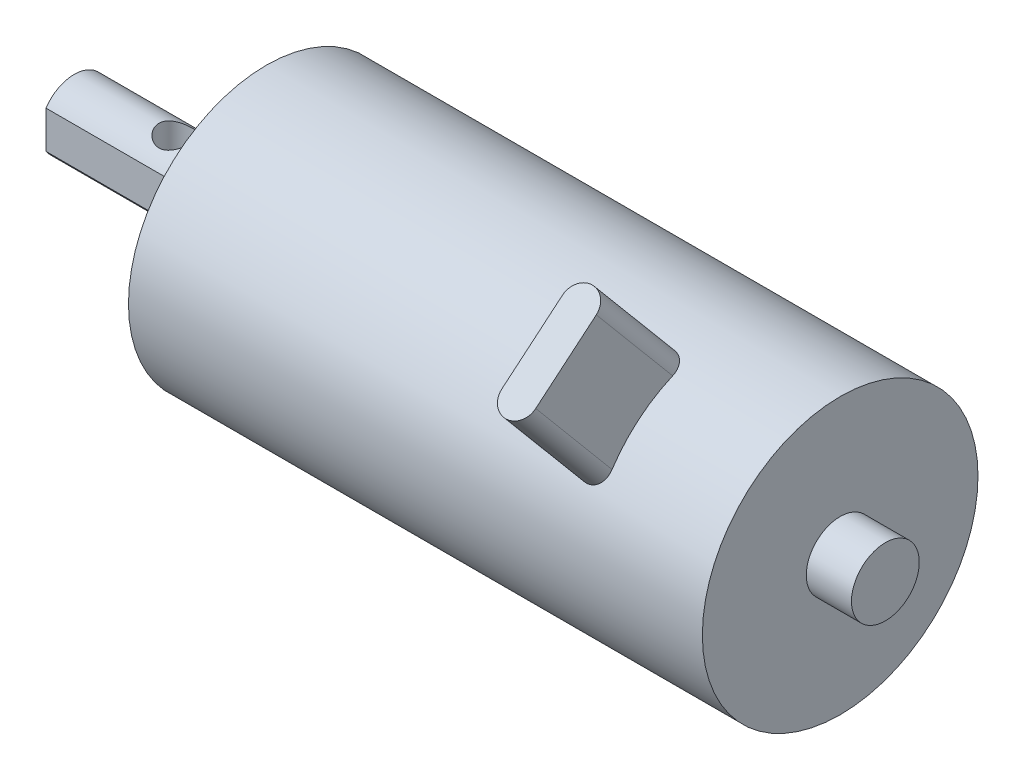
from build123d import *

# Parameters (mm, degrees)
HOLE_WIZARD_M3_1_D       = 2.5
HOLE_WIZARD_M3_1_DEPTH   = 4
HOLE_WIZARD_M3_1_TIP     = 0.751075774
CUT_EXTRUDE_1_DEPTH      = 10
CUT_EXTRUDE_1_DEPTH_BACK = 10
SKETCH_4_R               = 1.5
SKETCH_5_W               = 6.291710533
SKETCH_5_H               = 14.520159288
CUT_EXTRUDE_2_DEPTH      = 11.5
HOLE_WIZARD_M3_2_D       = 2.5
HOLE_WIZARD_M3_2_DEPTH   = 5.5
HOLE_WIZARD_M3_2_TIP     = 0.751075774
EXTRUDE_2_DEPTH          = 10
EXTRUDE_2_DEPTH_BACK     = 10
SKETCH_9_W               = 3
SKETCH_9_H               = 10
FILLET_2_R               = 1.5


with BuildPart() as part:
    # 草图1 → 旋转1 (revolve)
    with BuildSketch(Plane.XY, mode=Mode.PRIVATE) as revolve_1_sk:
        Polygon((-34.231351781, 0), (-34.231351781, 3), (-19.831351781, 3), (-19.831351781, 6.5), (-17.231351781, 6.5), (-17.231351781, 12.2), (33.568648219, 12.2), (33.568648219, 3), (37.568648219, 3), (37.568648219, 0), align=None)
    revolve(revolve_1_sk.sketch.rotate(Axis((-36.151898734, 0, 0), (1, 0, 0)), 90), axis=Axis((-36.151898734, 0, 0), (1, 0, 0)))

    # M3 螺纹孔1
    with Locations(Plane(origin=(-17.231351781, 9.5, 0), x_dir=(0, 0, -1), z_dir=(-1, 0, 0))):
        with Locations((0, 0), (8.227241336, 14.25), (-8.227241336, 14.25)):
            Hole(HOLE_WIZARD_M3_1_D / 2, depth=HOLE_WIZARD_M3_1_DEPTH)
            with Locations((0, 0, -(HOLE_WIZARD_M3_1_DEPTH + HOLE_WIZARD_M3_1_TIP / 2))):  # 118° drill point
                Cone(0, HOLE_WIZARD_M3_1_D / 2, HOLE_WIZARD_M3_1_TIP, mode=Mode.SUBTRACT)

    # 草图4 → 切除-拉伸1 (cut, two sides: drawn at the far end of the back side and taken through both)
    with BuildSketch(Plane(origin=(0, 0, 0), x_dir=(1, 0, 0), z_dir=(0, 1, 0)).offset(-CUT_EXTRUDE_1_DEPTH_BACK)):
        with Locations(Location((-25.231351781, 0, 0), (0, 0, 90))):
            Circle(SKETCH_4_R)
    extrude(amount=CUT_EXTRUDE_1_DEPTH + CUT_EXTRUDE_1_DEPTH_BACK, mode=Mode.SUBTRACT)

    # 草图5 → 切除-拉伸2 (cut)
    with BuildSketch(Plane.ZY.offset(34.231351781)):
        with Locations((5.645855266, 0)):
            Rectangle(SKETCH_5_W, SKETCH_5_H)
    extrude(amount=-CUT_EXTRUDE_2_DEPTH, mode=Mode.SUBTRACT)

    # M3 螺纹孔2
    with Locations(Plane.ZY.offset(34.231351781)):
        with Locations((0, 0)):
            Hole(HOLE_WIZARD_M3_2_D / 2, depth=HOLE_WIZARD_M3_2_DEPTH)
            with Locations((0, 0, -(HOLE_WIZARD_M3_2_DEPTH + HOLE_WIZARD_M3_2_TIP / 2))):  # 118° drill point
                Cone(0, HOLE_WIZARD_M3_2_D / 2, HOLE_WIZARD_M3_2_TIP, mode=Mode.SUBTRACT)

    # 草图9 → 凸台-拉伸2 (add, two sides: drawn at the far end of the back side and taken through both)
    with BuildSketch(Plane(origin=(0, 9.345742206, 7.842008838), x_dir=(1, 0, 0), z_dir=(0, 0.7660444431189817, 0.642787609686535)).offset(-EXTRUDE_2_DEPTH_BACK)):
        with Locations((22.068648219, 0)):
            Rectangle(SKETCH_9_W, SKETCH_9_H)
    extrude(amount=EXTRUDE_2_DEPTH + EXTRUDE_2_DEPTH_BACK)

    # 圆角2
    fillet_2_edges = [part.edges().sort_by_distance(p)[0] for p in [
        (23.568648219, 9.55155762, 14.541744923),
        (20.568648219, 9.55155762, 14.541744923),
        (23.568648219, 15.979433717, 6.881300491),
        (20.568648219, 15.979433717, 6.881300491),
    ]]
    fillet(fillet_2_edges, radius=FILLET_2_R - 0.0001)  # a hair under: the kernel refuses the full size


solid = part.part
